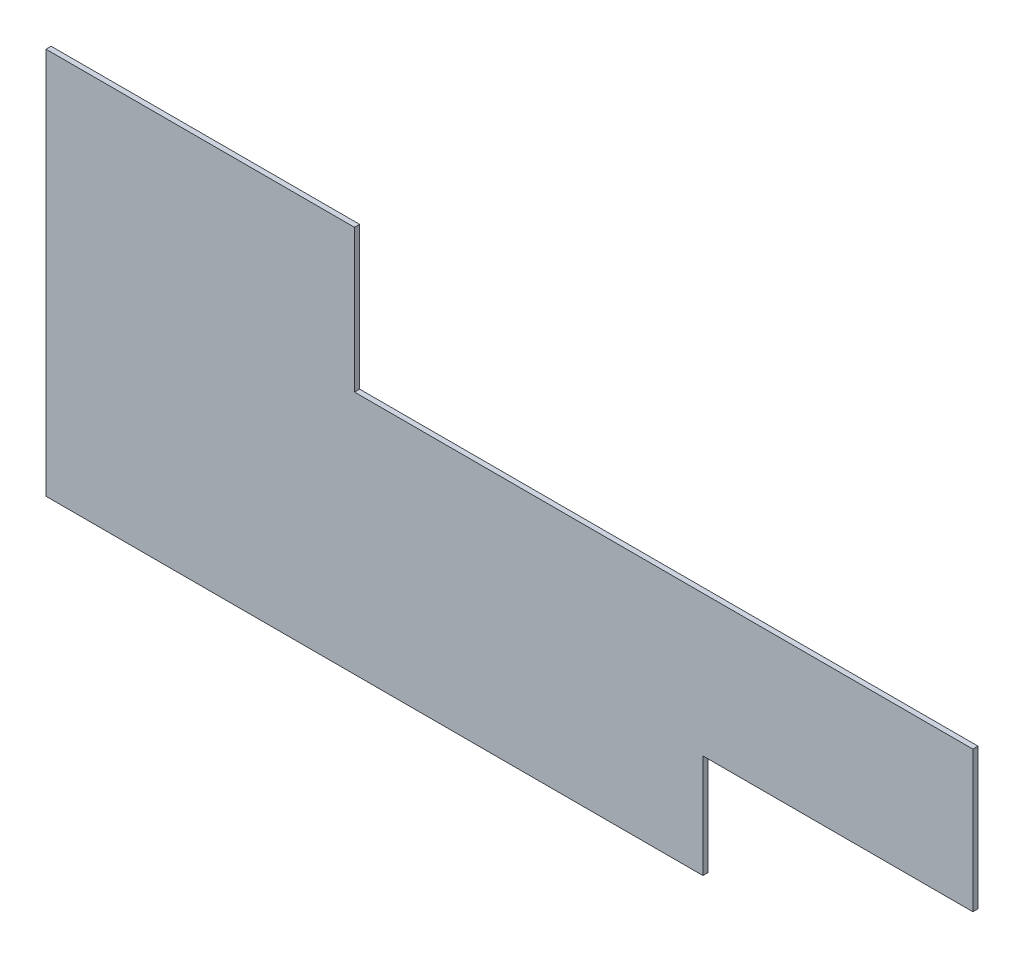
from build123d import *

# Parameters (mm, degrees)
TABAN_FLAN_1_DEPTH         = 20
KES_EKSTR_ZYON1_DEPTH      = 6196.848287361
KES_EKSTR_ZYON1_DEPTH_BACK = 6196.848287361
IZIM2_W                    = 3455
IZIM2_H                    = 403


# Sheet-metal steps are written as plain solids
with BuildPart() as part:
    # Çizim1 → Taban-Flanş1 (new body)
    with BuildSketch(Plane.XY):
        Polygon((0, 0), (1200, 0), (1200, -555), (3605, -555), (3605, -1103), (6010, -1103), (6010, -1506), (0, -1506), align=None)
    extrude(amount=-TABAN_FLAN_1_DEPTH)

    # Çizim2 → Kes-Ekstrüzyon1 (cut, two sides: drawn at the far end of the back side and taken through both)
    with BuildSketch(Plane.XY.offset(-KES_EKSTR_ZYON1_DEPTH_BACK)):
        with Locations((4282.5, -1304.5)):
            Rectangle(IZIM2_W, IZIM2_H)
    extrude(amount=KES_EKSTR_ZYON1_DEPTH + KES_EKSTR_ZYON1_DEPTH_BACK, mode=Mode.SUBTRACT)


solid = part.part
